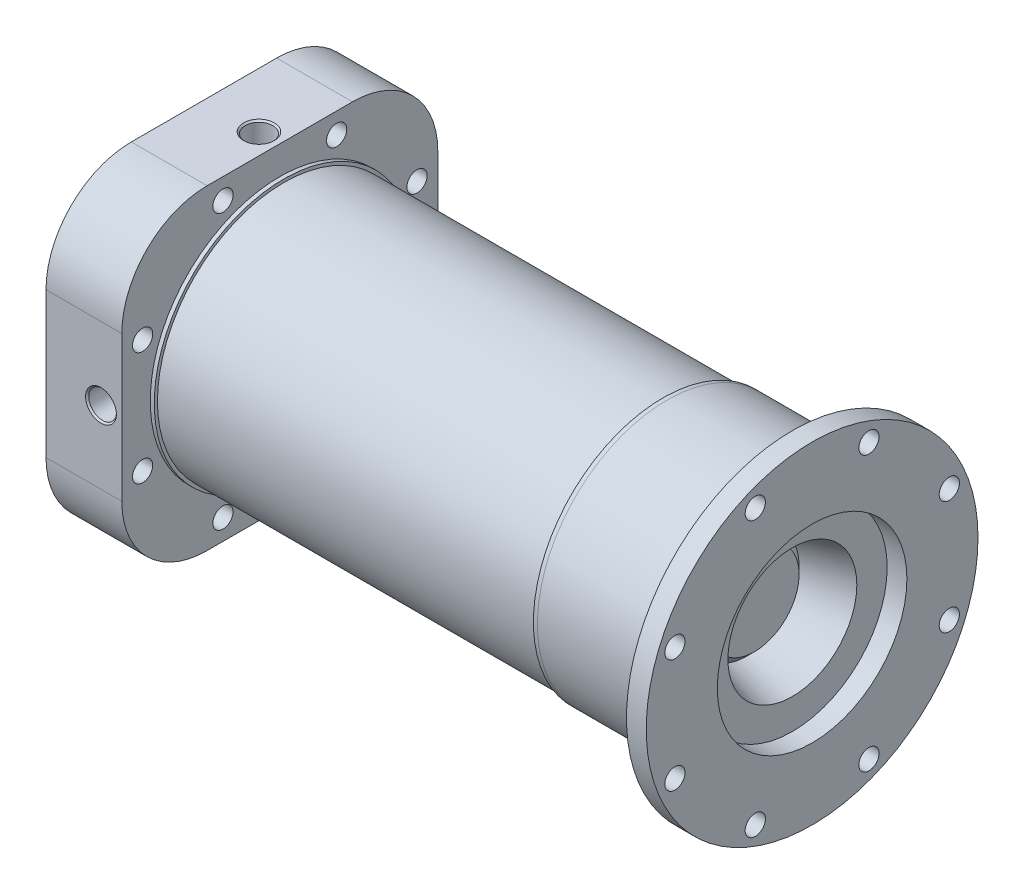
from build123d import *

# Parameters (mm, degrees)
FILLET1_R                = 1.27
CUT_EXTRUDE1_REACH       = 243.296
SKETCH2_R                = 3.81
CIRPATTERN1_COUNT        = 8
SKETCH4_R                = 63.5
BOSS_EXTRUDE1_DEPTH      = 31.75
SKETCH11_W               = 127
SKETCH11_H               = 127
BOSS_EXTRUDE2_DEPTH      = 31.75
SKETCH12_R               = 24.13
CUT_EXTRUDE4_DEPTH       = 16.51
CUT_EXTRUDE5_START       = -39.450428
SKETCH13_R               = 1.9685
CUT_EXTRUDE5_DEPTH       = 39.450428
CHAMFER1_SIZE            = 4.572
FILLET2_R                = 0.889
FILLET3_R                = 0.508
CUT_EXTRUDE9_REACH       = 267.18
CUT_EXTRUDE9_END_RADIUS  = 24.13
SKETCH31_R               = 1.5875
SKETCH37_W               = 127
SKETCH37_H               = 127
SKETCH37_R               = 43.688
CUT_EXTRUDE12_DEPTH      = 1.27
SKETCH32_R               = 69.85
SKETCH32_R_2             = 44.45
BOSS_EXTRUDE3_DEPTH      = 1.6002
SKETCH33_R               = 50.8
SKETCH33_R_2             = 44.45
BOSS_EXTRUDE4_DEPTH      = 152.4
BOSS_EXTRUDE5_START      = 154.0002
SKETCH32_2_R             = 69.85
SKETCH32_2_R_2           = 44.45
BOSS_EXTRUDE5_DEPTH      = 1.6002
FILLET4_R                = 0.254
FILLET5_R                = 1.27
FILLET6_R                = 34.29
CUT_EXTRUDE11_DEPTH      = 228.029206866
CUT_EXTRUDE11_DEPTH_BACK = 1.6002
SKETCH36_R               = 69.85
SKETCH36_R_2             = 52.07
SKETCH39_R               = 66.675
SKETCH39_R_2             = 38.1
BOSS_EXTRUDE6_DEPTH      = 7.9375
SKETCH40_R               = 4.064
CUT_EXTRUDE13_DEPTH      = 255.596964032
CIRPATTERN3_COUNT        = 8
FILLET7_R                = 3.81


# Read off the part's stored shape, not the designer's step: Ø6.7 (6.7) Diameter Hole1
with BuildPart() as part:
    # Chamber Revolve → Revolve1 (revolve)
    with BuildSketch(Plane.XY, mode=Mode.PRIVATE) as revolve1_sk:
        with BuildLine():
            Line((223.962313951, 63.5), (223.962313951, 25.908))
            Line((223.962313951, 25.908), (191.916500941, 17.321350283))
            ThreePointArc((191.916500941, 17.321350283), (190.601700192, 17.321350283), (189.463049342, 17.978750658))
            Line((189.463049342, 17.978750658), (173.5582, 33.8836))
            Line((173.5582, 33.8836), (0, 33.8836))
            Line((0, 33.8836), (0, 42.5196))
            Line((0, 42.5196), (3.8608, 42.5196))
            Line((3.8608, 42.5196), (3.8608, 48.5902))
            Line((3.8608, 48.5902), (0, 48.5902))
            Line((0, 48.5902), (0, 63.5))
            Line((0, 63.5), (10.16, 63.5))
            Line((10.16, 63.5), (10.16, 47.5996))
            Line((10.16, 47.5996), (24.13, 47.5996))
            Line((24.13, 47.5996), (24.13, 63.5))
            Line((24.13, 63.5), (223.962313951, 63.5))
        make_face()
    revolve(revolve1_sk.sketch.rotate(Axis((0, 0, 0), (1, 0, 0)), 90), axis=Axis((0, 0, 0), (1, 0, 0)))

    # Fillet1
    fillet1_edges = [part.edges().sort_by_distance(p)[0] for p in [
        (24.13, 0, -47.5996),
        (10.16, 0, -47.5996),
    ]]
    fillet(fillet1_edges, radius=FILLET1_R)

    # Sketch2 → Cut-Extrude1 (cut, up to next)
    with BuildSketch(Plane.ZY, mode=Mode.PRIVATE) as cut_extrude1_sk1:
        with Locations((-21.773156568, 52.565049882)):
            Circle(SKETCH2_R)
    cut_extrude1_tool1 = extrude(cut_extrude1_sk1.sketch, amount=-CUT_EXTRUDE1_REACH, mode=Mode.PRIVATE) & part.part
    cut_extrude1 = cut_extrude1_tool1.solids().sort_by_distance((0, 52.56505, -21.773157))[0]
    add(cut_extrude1, mode=Mode.SUBTRACT)

    # CirPattern1: Cut-Extrude1 ×8 about axis
    cirpattern1_axis = Axis((0, 0, 0), (1, 0, 0))
    for i in range(1, CIRPATTERN1_COUNT):
        add(cut_extrude1.rotate(cirpattern1_axis, i * 360 / CIRPATTERN1_COUNT), mode=Mode.SUBTRACT)

    # Fillet2
    fillet2_edges = [part.edges().sort_by_distance(p)[0] for p in [
        (3.8608, 0, -42.5196),
        (3.8608, 0, -48.5902),
    ]]
    fillet(fillet2_edges, radius=FILLET2_R)


with BuildPart() as body_2:
    # Sketch4 → Boss-Extrude1 (new body)
    with BuildSketch(Plane.ZY):
        Circle(SKETCH4_R)
    extrude(amount=BOSS_EXTRUDE1_DEPTH)

    # Sketch11 → Boss-Extrude2 (add)
    with BuildSketch(Plane.ZY.offset(31.75)):
        Rectangle(SKETCH11_W, SKETCH11_H)
    extrude(amount=-BOSS_EXTRUDE2_DEPTH)

    # Sketch12 → Cut-Extrude4 (cut)
    with BuildSketch(Plane(origin=(0, 0, 0), x_dir=(0, 0, -1), z_dir=(1, 0, 0))):
        Circle(SKETCH12_R)
    extrude(amount=-CUT_EXTRUDE4_DEPTH, mode=Mode.SUBTRACT)

    # Sketch13 → Cut-Extrude5 (cut)
    with BuildSketch(Plane.XY.offset(63.5).offset(CUT_EXTRUDE5_START)):
        with Locations((-9.652, 0)):
            Circle(SKETCH13_R)
    cut_extrude5 = extrude(amount=CUT_EXTRUDE5_DEPTH, mode=Mode.SUBTRACT)

    # Chamfer1
    chamfer1_edges = [body_2.edges().sort_by_distance(p)[0] for p in [
        (0, 0, 24.13),
    ]]
    chamfer(chamfer1_edges, length=CHAMFER1_SIZE)

    # Sketch20 → 7/16 (0.4375) Diameter Hole1 (revolve, cut)
    with BuildSketch(Plane(origin=(-9.652, 0, 63.5), x_dir=(0, -1, 0), z_dir=(1, 0, 0))):
        Polygon((0, 0), (0, 22.388531814), (5.55625, 19.05), (5.55625, 0.635), (6.19125, 0), align=None)
    f_7_16_0_4375_diameter_hole1 = revolve(axis=Axis((-9.652, 0, 69.85), (0, 0, -1)), mode=Mode.SUBTRACT)

    # Mirror1: Cut-Extrude5, 7/16 (0.4375) Diameter Hole1 across plane
    add(cut_extrude5.mirror(Plane.XY), mode=Mode.SUBTRACT)
    add(f_7_16_0_4375_diameter_hole1.mirror(Plane.XY), mode=Mode.SUBTRACT)

    # Ø6.7 (6.7) Diameter Hole1 outline → Ø6.7 (6.7) Diameter Hole1 (revolve, cut)
    with BuildSketch(Plane(origin=(0, -33.02, 0), x_dir=(0, 1, 0), z_dir=(0, 0, -1))):
        Polygon((3.35, -16.256), (0, -14.243116926), (0, -31.75), (3.75, -31.75), (3.35, -31.35), align=None)
    f_6_7_6_7_diameter_hole1 = revolve(axis=Axis((0, -33.02, 0), (1, 0, 0)), mode=Mode.SUBTRACT)

    # Mirror2: Ø6.7 (6.7) Diameter Hole1 across plane
    add(f_6_7_6_7_diameter_hole1.mirror(Plane.ZX), mode=Mode.SUBTRACT)

    # Sketch24 → Cut-Revolve1 (revolve, cut)
    with BuildSketch(Plane(origin=(0, 0, 0), x_dir=(1, 0, 0), z_dir=(0, 1, 0))):
        with BuildLine():
            Line((-31.75, 7.1374), (-30.958106371, 5.7658))
            Line((-30.958106371, 5.7658), (-29.845, 5.7658))
            ThreePointArc((-29.845, 5.7658), (-29.650596816, 5.727130803), (-29.485789755, 5.617010245))
            Line((-29.485789755, 5.617010245), (-28.73287951, 4.8641))
            Line((-28.73287951, 4.8641), (-16.51, 4.8641))
            Line((-16.51, 4.8641), (-16.51, 0))
            Line((-16.51, 0), (-31.75, 0))
            Line((-31.75, 0), (-31.75, 7.1374))
        make_face()
    revolve(axis=Axis((223.962313951, 0, 0), (-1, 0, 0)), mode=Mode.SUBTRACT)

    # Fillet3
    fillet3_edges = [body_2.edges().sort_by_distance(p)[0] for p in [
        (-30.958106371, 0, 5.7658),
    ]]
    fillet(fillet3_edges, radius=FILLET3_R)

    # Sketch30 → 7/16 (0.4375) Diameter Hole2 (revolve, cut)
    with BuildSketch(Plane(origin=(-9.652, -63.5, 0), x_dir=(0, 0, -1), z_dir=(1, 0, 0))):
        Polygon((0, 0), (0, 22.388531814), (5.55625, 19.05), (5.55625, 0.635), (6.19125, 0), align=None)
    f_7_16_0_4375_diameter_hole2 = revolve(axis=Axis((-9.652, -69.85, 0), (0, 1, 0)), mode=Mode.SUBTRACT)

    # Cut-Extrude9: up to this cylinder (the profile starts outside it)
    cut_extrude9_end = Plane(origin=(-9.652, 0, 0), z_dir=(1, 0, 0)) * Cylinder(CUT_EXTRUDE9_END_RADIUS, 583.62, mode=Mode.PRIVATE)
    # Sketch31 → Cut-Extrude9 (cut, up to the surface)
    with BuildSketch(Plane.XZ.offset(63.5), mode=Mode.PRIVATE) as cut_extrude9_sk1:
        with Locations(Location((-9.652, 0, 0), (0, 0, 270))):
            Circle(SKETCH31_R)
    cut_extrude9_tool1 = extrude(cut_extrude9_sk1.sketch, amount=-CUT_EXTRUDE9_REACH, mode=Mode.PRIVATE) - cut_extrude9_end
    cut_extrude9 = cut_extrude9_tool1.solids().sort_by_distance((-9.652, -63.5, 0))[0]
    add(cut_extrude9, mode=Mode.SUBTRACT)

    # Mirror3: 7/16 (0.4375) Diameter Hole2, Cut-Extrude9 across plane
    add(f_7_16_0_4375_diameter_hole2.mirror(Plane.ZX), mode=Mode.SUBTRACT)
    add(cut_extrude9.mirror(Plane.ZX), mode=Mode.SUBTRACT)

    # Sketch37 → Cut-Extrude12 (cut)
    with BuildSketch(Plane(origin=(0, 0, 0), x_dir=(0, 0, -1), z_dir=(1, 0, 0))):
        Rectangle(SKETCH37_W, SKETCH37_H)
        Circle(SKETCH37_R, mode=Mode.SUBTRACT)
    extrude(amount=-CUT_EXTRUDE12_DEPTH, mode=Mode.SUBTRACT)

    # Fillet6
    fillet6_edges = [body_2.edges().sort_by_distance(p)[0] for p in [
        (-16.51, 63.5, 63.5),
        (-16.51, -63.5, 63.5),
        (-16.51, -63.5, -63.5),
        (-16.51, 63.5, -63.5),
    ]]
    fillet(fillet6_edges, radius=FILLET6_R)


with BuildPart() as body_3:
    # Sketch21 → Revolve2 (revolve)
    with BuildSketch(Plane(origin=(0, 0, 0), x_dir=(1, 0, 0), z_dir=(0, 1, 0))):
        Polygon((0, 33.8836), (173.5582, 33.8836), (189.463049342, 17.978750658), (189.463049342, 0), (0, 0), align=None)
    revolve(axis=Axis((189.463049342, 0, 0), (1, 0, 0)))


with BuildPart() as body_3_2:
    # Sketch32 → Boss-Extrude3 (new body)
    with BuildSketch(Plane(origin=(-1.27, 0, 0), x_dir=(0, 0, -1), z_dir=(1, 0, 0))):
        Circle(SKETCH32_R)
        Circle(SKETCH32_R_2, mode=Mode.SUBTRACT)
    extrude(amount=BOSS_EXTRUDE3_DEPTH)


with BuildPart() as body_4:
    # Sketch33 → Boss-Extrude4 (new body)
    with BuildSketch(Plane(origin=(0.3302, 0, 0), x_dir=(0, 0, -1), z_dir=(1, 0, 0))):
        with Locations(Location((0, 0, 0), (0, 0, 180))):
            Circle(SKETCH33_R)
        with Locations(Location((0, 0, 0), (0, 0, 180))):
            Circle(SKETCH33_R_2, mode=Mode.SUBTRACT)
    extrude(amount=BOSS_EXTRUDE4_DEPTH)


with BuildPart() as body_5:
    # Sketch32<2> → Boss-Extrude5 (new body)
    with BuildSketch(Plane(origin=(-1.27, 0, 0), x_dir=(0, 0, -1), z_dir=(1, 0, 0)).offset(BOSS_EXTRUDE5_START)):
        Circle(SKETCH32_2_R)
        Circle(SKETCH32_2_R_2, mode=Mode.SUBTRACT)
    extrude(amount=BOSS_EXTRUDE5_DEPTH)


with BuildPart() as body_6:
    # Sketch34 → Revolve3 (revolve)
    with BuildSketch(Plane.XY, mode=Mode.PRIVATE) as revolve3_sk:
        Polygon((154.3304, 52.07), (154.3304, 43.688), (151.7904, 43.688), (151.7904, 41.148), (154.3304, 41.148), (171.279763711, 16.9418), (204.742077662, 25.908), (204.742077662, 52.07), align=None)
    revolve(revolve3_sk.sketch.rotate(Axis((152.7302, 0, 0), (-1, 0, 0)), 90), axis=Axis((152.7302, 0, 0), (-1, 0, 0)))

    # Fillet4
    fillet4_edges = [body_6.edges().sort_by_distance(p)[0] for p in [
        (154.3304, 0, 43.688),
    ]]
    fillet(fillet4_edges, radius=FILLET4_R)

    # Fillet5
    fillet5_edges = [body_6.edges().sort_by_distance(p)[0] for p in [
        (171.279763711, 0, 16.9418),
    ]]
    fillet(fillet5_edges, radius=FILLET5_R)

    # Fillet7
    fillet7_edges = [body_6.edges().sort_by_distance(p)[0] for p in [
        (154.3304, 0, 41.148),
    ]]
    fillet(fillet7_edges, radius=FILLET7_R)


with BuildPart() as cut_extrude11_tool:
    # Sketch36 → Cut-Extrude11 (new, two sides: drawn at the far end of the back side and taken through both)
    with BuildSketch(Plane(origin=(0.3302, 0, 0), x_dir=(0, 0, -1), z_dir=(1, 0, 0)).offset(-CUT_EXTRUDE11_DEPTH_BACK)):
        Circle(SKETCH36_R)
        Circle(SKETCH36_R_2, mode=Mode.SUBTRACT)
    extrude(amount=CUT_EXTRUDE11_DEPTH + CUT_EXTRUDE11_DEPTH_BACK)


with BuildPart() as body_3_2_1:
    add(body_3_2.part)

    # Cut-Extrude11: cut by cut_extrude11_tool
    add(cut_extrude11_tool.part, mode=Mode.SUBTRACT)


with BuildPart() as body_5_1:
    add(body_5.part)

    # Cut-Extrude11: cut by cut_extrude11_tool
    add(cut_extrude11_tool.part, mode=Mode.SUBTRACT)


with BuildPart() as body_7:
    # Sketch39 → Boss-Extrude6 (new body)
    with BuildSketch(Plane(origin=(204.742077662, 0, 0), x_dir=(0, 0, -1), z_dir=(1, 0, 0))):
        Circle(SKETCH39_R)
        Circle(SKETCH39_R_2, mode=Mode.SUBTRACT)
    extrude(amount=BOSS_EXTRUDE6_DEPTH)


with BuildPart() as cut_extrude13_tool:
    # Sketch40 → Cut-Extrude13 (new, symmetric)
    with BuildSketch(Plane.ZY.offset(-204.742077662)):
        with Locations(Location((-22.842374078, 55.146369296, 0), (0, 0, 180))):
            Circle(SKETCH40_R)
    cut_extrude13 = extrude(amount=CUT_EXTRUDE13_DEPTH, both=True)


with BuildPart() as body_2_1:
    add(body_2.part)

    # Cut-Extrude13: cut by cut_extrude13_tool
    add(cut_extrude13_tool.part, mode=Mode.SUBTRACT)


with BuildPart() as body_7_1:
    add(body_7.part)

    # Cut-Extrude13: cut by cut_extrude13_tool
    add(cut_extrude13_tool.part, mode=Mode.SUBTRACT)


with BuildPart() as cirpattern3_tool:
    # CirPattern3: Cut-Extrude13 ×8 about axis
    cirpattern3_axis = Axis((0, 0, 0), (1, 0, 0))
    for i in range(1, CIRPATTERN3_COUNT):
        add(cut_extrude13.rotate(cirpattern3_axis, i * 360 / CIRPATTERN3_COUNT))


with BuildPart() as body_2_2:
    add(body_2_1.part)

    # CirPattern3: cut by cirpattern3_tool
    add(cirpattern3_tool.part, mode=Mode.SUBTRACT)


with BuildPart() as body_7_2:
    add(body_7_1.part)

    # CirPattern3: cut by cirpattern3_tool
    add(cirpattern3_tool.part, mode=Mode.SUBTRACT)


solid = Compound([body_3.part, body_4.part, body_6.part, body_3_2_1.part, body_5_1.part, body_2_2.part, body_7_2.part])
